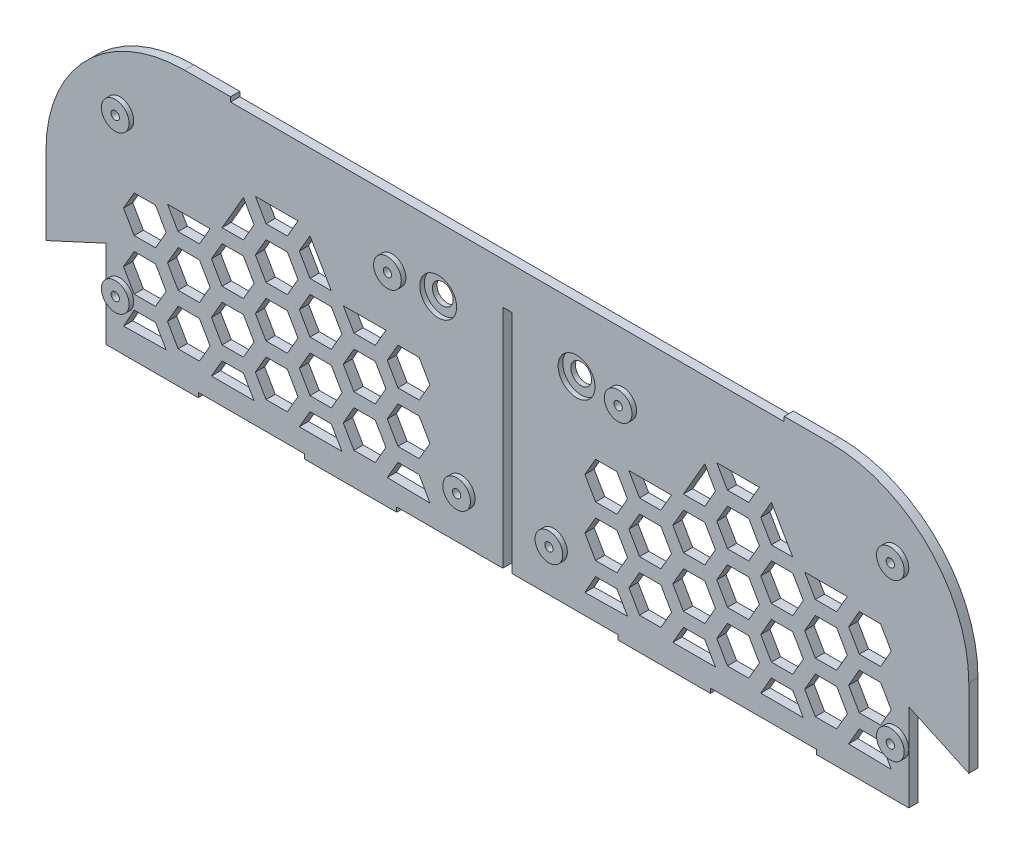
from build123d import *

# Parameters (mm, degrees)
EXTRUDE_1_DEPTH                = 2
CUT_EXTRUDE_2_DEPTH            = 2
HOLE_WIZARD_M4_1_D             = 4.5
HOLE_WIZARD_M4_1_CBORE_D       = 8
HOLE_WIZARD_M4_1_CBORE_DEPTH   = 1
HOLE_WIZARD_M1_6_1_D           = 1.8
HOLE_WIZARD_M1_6_1_CBORE_D     = 3.5
HOLE_WIZARD_M1_6_1_CBORE_DEPTH = 1.6
EXTRUDE_START                  = 1
SKETCH_9_R                     = 3
SKETCH_9_R_2                   = 0.9
EXTRUDE_2_DEPTH                = 1


# Read off the part's stored shape, not the designer's step: 切除-拉伸2
with BuildPart() as part:
    # 草图1 → 凸台-拉伸1 (new body)
    with BuildSketch(Plane.XY):
        with BuildLine():
            Line((-87, 0), (-87, 19))
            Line((-87, 19), (-100, 13))
            Line((-100, 13), (-100, 30))
            ThreePointArc((-100, 30), (-91.213203436, 51.213203436), (-70, 60))
            Line((-70, 60), (-60, 60))
            Line((-60, 60), (-60, 59))
            Line((-60, 59), (60, 59))
            Line((60, 59), (60, 60))
            Line((60, 60), (70, 60))
            ThreePointArc((70, 60), (91.213203436, 51.213203436), (100, 30))
            Line((100, 30), (100, 13))
            Line((100, 13), (87, 19))
            Line((87, 19), (87, 0))
            Line((87, 0), (67, 0))
            Line((67, 0), (67, 1))
            Line((67, 1), (44, 1))
            Line((44, 1), (44, 0))
            Line((44, 0), (24, 0))
            Line((24, 0), (24, 1))
            Line((24, 1), (1, 1))
            Line((1, 1), (1, 50))
            Line((1, 50), (-1, 50))
            Line((-1, 50), (-1, 1))
            Line((-1, 1), (-24, 1))
            Line((-24, 1), (-24, 0))
            Line((-24, 0), (-44, 0))
            Line((-44, 0), (-44, 1))
            Line((-44, 1), (-67, 1))
            Line((-67, 1), (-67, 0))
            Line((-67, 0), (-87, 0))
        make_face()
    extrude(amount=EXTRUDE_1_DEPTH)

    # 切除-拉伸2 outline → 切除-拉伸2 (cut)
    with BuildSketch(Plane.XY):
        Polygon((-19.112359522, 9.5), (-23.731161675, 9.5), (-26.040562752, 5.5), (-16.802958445, 5.34174435), align=None)
        Polygon((42.782522712, 9.5), (38.163720558, 9.5), (35.854319482, 5.5), (45.091923789, 5.5), align=None)
        Polygon((-38.164918405, 9.5), (-42.783720558, 9.5), (-45.093121635, 5.5), (-35.855517328, 5.5), align=None)
        Polygon((-57.217477288, 9.5), (-61.836279442, 9.5), (-64.145680518, 5.5), (-54.908076211, 5.5), align=None)
        Polygon((23.729963829, 9.5), (19.111161675, 9.5), (16.801760598, 5.34174435), (26.039364905, 5.5), align=None)
        Polygon((61.835081595, 9.5), (57.216279442, 9.5), (54.906878365, 5.5), (64.144482672, 5.5), align=None)
        Polygon((80.887640478, 9.5), (76.268838325, 9.5), (73.959437248, 5.5), (83.197041555, 5.34174435), align=None)
        Polygon((-76.270036171, 9.5), (-80.888838325, 9.5), (-83.198239402, 5.34174435), (-73.960635095, 5.5), align=None)
        Polygon((47.69, 18), (52.308802154, 18), (54.61820323, 22), (52.308802154, 26), (47.69, 26), (45.380598923, 22), align=None)
        Polygon((28.637441117, 18), (33.25624327, 18), (35.565644347, 22), (33.25624327, 26), (28.637441117, 26), (26.32804004, 22), align=None)
        Polygon((-33.257441117, 18), (-28.638638963, 18), (-26.329237886, 22), (-28.638638963, 26), (-33.257441117, 26), (-35.566842194, 22), align=None)
        Polygon((-71.362558883, 18), (-66.74375673, 18), (-64.434355653, 22), (-66.74375673, 26), (-71.362558883, 26), (-73.67195996, 22), align=None)
        Polygon((66.742558883, 18), (71.361361037, 18), (73.670762114, 22), (71.361361037, 26), (66.742558883, 26), (64.433157806, 22), align=None)
        Polygon((-52.31, 18), (-47.691197846, 18), (-45.38179677, 22), (-47.691197846, 26), (-52.31, 26), (-54.619401077, 22), align=None)
        Polygon((45.091923789, 38.5), (42.782522712, 42.5), (38.163720558, 34.5), (42.782522712, 34.5), align=None)
        Polygon((57.216279442, 42.5), (54.906878365, 38.5), (57.216279442, 34.5), (61.835081595, 34.5), align=None)
        Polygon((47.69, 29), (52.308802154, 29), (54.61820323, 33), (52.308802154, 37), (47.69, 37), (45.380598923, 33), align=None)
        Polygon((28.637441117, 29), (33.25624327, 29), (35.565644347, 33), (26.32804004, 33), align=None)
        Polygon((66.742558883, 29), (71.361361037, 29), (73.670762114, 33), (64.433157806, 33), align=None)
        Polygon((-33.257441117, 29), (-28.638638963, 29), (-26.329237886, 33), (-35.566842194, 33), align=None)
        Polygon((-71.362558883, 29), (-66.74375673, 29), (-64.434355653, 33), (-73.67195996, 33), align=None)
        Polygon((-52.31, 29), (-47.691197846, 29), (-45.38179677, 33), (-47.691197846, 37), (-52.31, 37), (-54.619401077, 33), align=None)
        Polygon((42.782522712, 12.5), (45.091923789, 16.5), (42.782522712, 20.5), (38.163720558, 20.5), (35.854319482, 16.5), (38.163720558, 12.5), align=None)
        Polygon((64.144482672, 16.5), (61.835081595, 20.5), (57.216279442, 20.5), (54.906878365, 16.5), (57.216279442, 12.5), (61.835081595, 12.5), align=None)
        Polygon((-42.783720558, 34.5), (-38.164918405, 34.5), (-42.783720558, 42.5), (-45.093121635, 38.5), align=None)
        Polygon((-61.836279442, 34.5), (-57.217477288, 34.5), (-54.908076211, 38.5), (-57.217477288, 42.5), align=None)
        Polygon((23.729963829, 12.5), (26.039364905, 16.5), (23.729963829, 20.5), (19.111161675, 20.5), (16.801760598, 16.5), (19.111161675, 12.5), align=None)
        Polygon((61.835081595, 23.5), (64.144482672, 27.5), (61.835081595, 31.5), (57.216279442, 31.5), (54.906878365, 27.5), (57.216279442, 23.5), align=None)
        Polygon((52.308802154, 7), (54.61820323, 11), (52.308802154, 15), (47.69, 15), (45.380598923, 11), (47.69, 7), align=None)
        Polygon((73.670762114, 11), (71.361361037, 15), (66.742558883, 15), (64.433157806, 11), (66.742558883, 7), (71.361361037, 7), align=None)
        Polygon((23.729963829, 31.5), (19.111161675, 31.5), (16.801760598, 27.5), (19.111161675, 23.5), (23.729963829, 23.5), (26.039364905, 27.5), align=None)
        Polygon((42.782522712, 31.5), (38.163720558, 31.5), (35.854319482, 27.5), (38.163720558, 23.5), (42.782522712, 23.5), (45.091923789, 27.5), align=None)
        Polygon((-38.164918405, 31.5), (-42.783720558, 31.5), (-45.093121635, 27.5), (-42.783720558, 23.5), (-38.164918405, 23.5), (-35.855517328, 27.5), align=None)
        Polygon((-19.112359522, 31.5), (-23.731161675, 31.5), (-26.040562752, 27.5), (-23.731161675, 23.5), (-19.112359522, 23.5), (-16.802958445, 27.5), align=None)
        Polygon((-76.270036171, 31.5), (-80.888838325, 31.5), (-83.198239402, 27.5), (-80.888838325, 23.5), (-76.270036171, 23.5), (-73.960635095, 27.5), align=None)
        Polygon((-57.217477288, 31.5), (-61.836279442, 31.5), (-64.145680518, 27.5), (-61.836279442, 23.5), (-57.217477288, 23.5), (-54.908076211, 27.5), align=None)
        Polygon((80.887640478, 31.5), (76.268838325, 31.5), (73.959437248, 27.5), (76.268838325, 23.5), (80.887640478, 23.5), (83.197041555, 27.5), align=None)
        Polygon((45.380598923, 44), (47.69, 40), (52.308802154, 40), (54.61820323, 44), align=None)
        Polygon((73.959437248, 16.5), (76.268838325, 12.5), (80.887640478, 12.5), (83.197041555, 16.5), (80.887640478, 20.5), (76.268838325, 20.5), align=None)
        Polygon((-23.731161675, 12.5), (-19.112359522, 12.5), (-16.802958445, 16.5), (-19.112359522, 20.5), (-23.731161675, 20.5), (-26.040562752, 16.5), align=None)
        Polygon((-42.783720558, 12.5), (-38.164918405, 12.5), (-35.855517328, 16.5), (-38.164918405, 20.5), (-42.783720558, 20.5), (-45.093121635, 16.5), align=None)
        Polygon((-61.836279442, 12.5), (-57.217477288, 12.5), (-54.908076211, 16.5), (-57.217477288, 20.5), (-61.836279442, 20.5), (-64.145680518, 16.5), align=None)
        Polygon((-80.888838325, 12.5), (-76.270036171, 12.5), (-73.960635095, 16.5), (-76.270036171, 20.5), (-80.888838325, 20.5), (-83.198239402, 16.5), align=None)
        Polygon((28.637441117, 7), (33.25624327, 7), (35.565644347, 11), (33.25624327, 15), (28.637441117, 15), (26.32804004, 11), align=None)
        Polygon((-33.257441117, 7), (-28.638638963, 7), (-26.329237886, 11), (-28.638638963, 15), (-33.257441117, 15), (-35.566842194, 11), align=None)
        Polygon((-52.31, 7), (-47.691197846, 7), (-45.38179677, 11), (-47.691197846, 15), (-52.31, 15), (-54.619401077, 11), align=None)
        Polygon((-71.362558883, 7), (-66.74375673, 7), (-64.434355653, 11), (-66.74375673, 15), (-71.362558883, 15), (-73.67195996, 11), align=None)
        Polygon((-54.619401077, 44), (-52.31, 40), (-47.691197846, 40), (-45.38179677, 44), align=None)
    extrude(amount=CUT_EXTRUDE_2_DEPTH, mode=Mode.SUBTRACT)

    # M4 六角凹头盖的柱孔1 (through all)
    with Locations(Plane(origin=(-15, 45, 2), x_dir=(1, 0, 0), z_dir=(0, 0, 1))):
        with Locations((0, 0), (30, 0)):
            CounterBoreHole(HOLE_WIZARD_M4_1_D / 2, HOLE_WIZARD_M4_1_CBORE_D / 2, HOLE_WIZARD_M4_1_CBORE_DEPTH)

    # M1.6 六角凹头盖的柱孔1 (through all)
    with Locations(Plane(origin=(84, 11, 0), x_dir=(-1, 0, 0), z_dir=(0, 0, -1))):
        with Locations((0, 0), (168, 0), (0, 34), (59, 34), (74, 0), (94, 0), (109, 34), (168, 34)):
            CounterBoreHole(HOLE_WIZARD_M1_6_1_D / 2, HOLE_WIZARD_M1_6_1_CBORE_D / 2, HOLE_WIZARD_M1_6_1_CBORE_DEPTH)

    # 草图9 → 凸台-拉伸2 (add)
    # profile 1 of 8: a face of its own
    with BuildSketch(Plane.XY.offset(2).offset(EXTRUDE_START)):
        with Locations((-84, 45)):
            Circle(SKETCH_9_R)
        with Locations(Location((-84, 45, 0), (0, 0, 180))):
            Circle(SKETCH_9_R_2, mode=Mode.SUBTRACT)
    # profile 2 of 8: a face of its own
    with BuildSketch(Plane.XY.offset(2).offset(EXTRUDE_START)):
        with Locations(Location((-84, 11, 0), (0, 0, 180))):
            Circle(SKETCH_9_R)
        with Locations(Location((-84, 11, 0), (0, 0, 180))):
            Circle(SKETCH_9_R_2, mode=Mode.SUBTRACT)
    # profile 3 of 8: a face of its own
    with BuildSketch(Plane.XY.offset(2).offset(EXTRUDE_START)):
        with Locations((-25, 45)):
            Circle(SKETCH_9_R)
        with Locations(Location((-25, 45, 0), (0, 0, 180))):
            Circle(SKETCH_9_R_2, mode=Mode.SUBTRACT)
    # profile 4 of 8: a face of its own
    with BuildSketch(Plane.XY.offset(2).offset(EXTRUDE_START)):
        with Locations((-10, 11)):
            Circle(SKETCH_9_R)
        with Locations(Location((-10, 11, 0), (0, 0, 180))):
            Circle(SKETCH_9_R_2, mode=Mode.SUBTRACT)
    # profile 5 of 8: a face of its own
    with BuildSketch(Plane.XY.offset(2).offset(EXTRUDE_START)):
        with Locations(Location((10, 11, 0), (0, 0, 180))):
            Circle(SKETCH_9_R)
        with Locations(Location((10, 11, 0), (0, 0, 180))):
            Circle(SKETCH_9_R_2, mode=Mode.SUBTRACT)
    # profile 6 of 8: a face of its own
    with BuildSketch(Plane.XY.offset(2).offset(EXTRUDE_START)):
        with Locations(Location((25, 45, 0), (0, 0, 180))):
            Circle(SKETCH_9_R)
        with Locations(Location((25, 45, 0), (0, 0, 180))):
            Circle(SKETCH_9_R_2, mode=Mode.SUBTRACT)
    # profile 7 of 8: a face of its own
    with BuildSketch(Plane.XY.offset(2).offset(EXTRUDE_START)):
        with Locations(Location((84, 11, 0), (0, 0, 180))):
            Circle(SKETCH_9_R)
        with Locations(Location((84, 11, 0), (0, 0, 180))):
            Circle(SKETCH_9_R_2, mode=Mode.SUBTRACT)
    # profile 8 of 8: a face of its own
    with BuildSketch(Plane.XY.offset(2).offset(EXTRUDE_START)):
        with Locations(Location((84, 45, 0), (0, 0, 180))):
            Circle(SKETCH_9_R)
        with Locations(Location((84, 45, 0), (0, 0, 180))):
            Circle(SKETCH_9_R_2, mode=Mode.SUBTRACT)
    extrude(amount=-EXTRUDE_2_DEPTH)


solid = part.part
